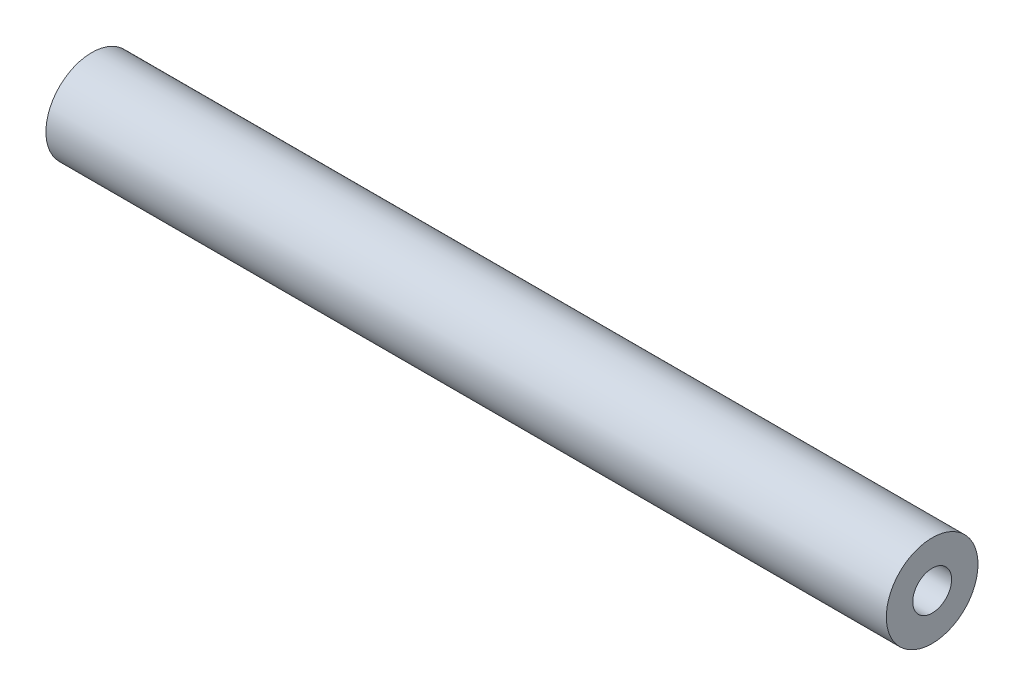
from build123d import *

# Parameters (mm, degrees)
SKETCH1_R                            = 4.7625
BOSS_EXTRUDE1_DEPTH                  = 43.65625
F_10_32_TAPPED_HOLE1_D               = 4.0386
F_10_32_TAPPED_HOLE1_DEPTH           = 16.256
F_10_32_TAPPED_HOLE1_TIP             = 1.213317848
F_10_32_TAPPED_HOLE1_ON_FACE_2_D     = 4.0386
F_10_32_TAPPED_HOLE1_ON_FACE_2_DEPTH = 16.256
F_10_32_TAPPED_HOLE1_ON_FACE_2_TIP   = 1.213317848


with BuildPart() as part:
    # Sketch1 → Boss-Extrude1 (new, symmetric)
    with BuildSketch(Plane(origin=(0, 0, 0), x_dir=(0, 0, -1), z_dir=(1, 0, 0))):
        Circle(SKETCH1_R)
    extrude(amount=BOSS_EXTRUDE1_DEPTH, both=True)

    # #10-32 Tapped Hole1
    with Locations(Plane(origin=(43.65625, 0, 0), x_dir=(0, 0, 1), z_dir=(1, 0, 0))):
        with Locations((0, 0)):
            Hole(F_10_32_TAPPED_HOLE1_D / 2, depth=F_10_32_TAPPED_HOLE1_DEPTH)
            with Locations((0, 0, -(F_10_32_TAPPED_HOLE1_DEPTH + F_10_32_TAPPED_HOLE1_TIP / 2))):  # 118° drill point
                Cone(0, F_10_32_TAPPED_HOLE1_D / 2, F_10_32_TAPPED_HOLE1_TIP, mode=Mode.SUBTRACT)

    # #10-32 Tapped Hole1 on face 2
    with Locations(Plane(origin=(-43.65625, 0, 0), x_dir=(0, 0, -1), z_dir=(-1, 0, 0))):
        with Locations((0, 0)):
            Hole(F_10_32_TAPPED_HOLE1_ON_FACE_2_D / 2, depth=F_10_32_TAPPED_HOLE1_ON_FACE_2_DEPTH)
            with Locations((0, 0, -(F_10_32_TAPPED_HOLE1_ON_FACE_2_DEPTH + F_10_32_TAPPED_HOLE1_ON_FACE_2_TIP / 2))):  # 118° drill point
                Cone(0, F_10_32_TAPPED_HOLE1_ON_FACE_2_D / 2, F_10_32_TAPPED_HOLE1_ON_FACE_2_TIP, mode=Mode.SUBTRACT)


solid = part.part
